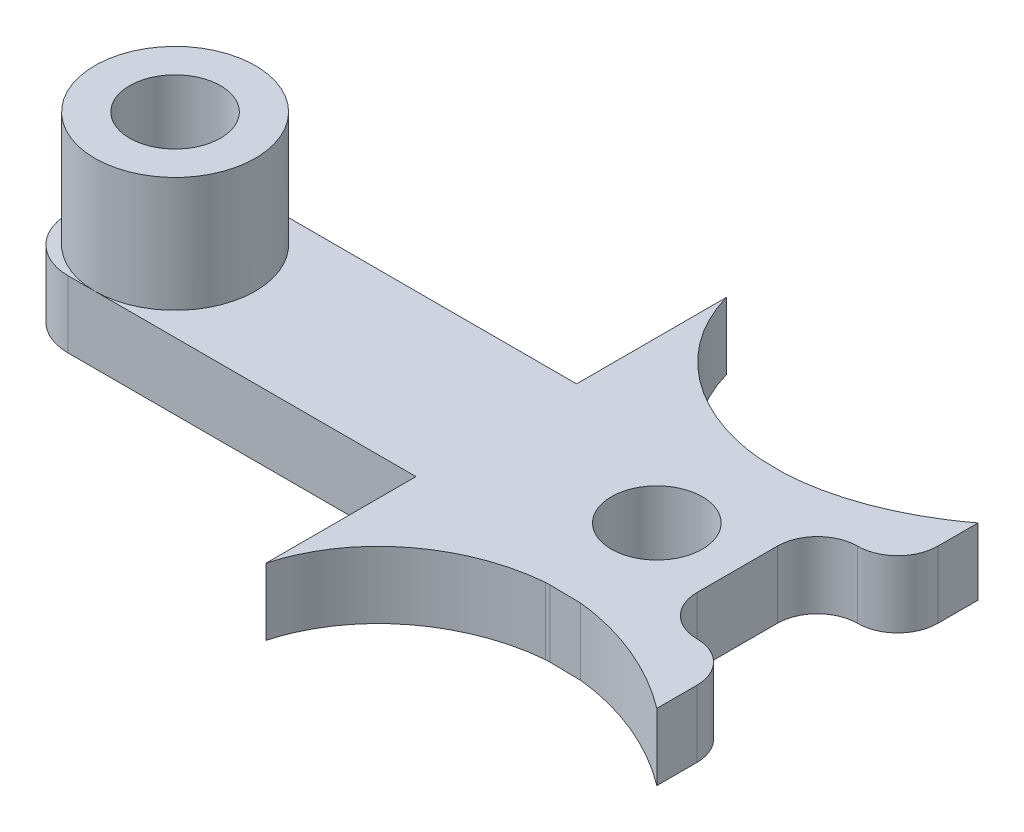
from build123d import *

# Parameters (mm, degrees)
SKETCH_1_R          = 1.7
EXTRUDE_1_DEPTH     = 2.5
SKETCH_3_R          = 3
SKETCH_3_R_2        = 1.7
EXTRUDE_2_DEPTH     = 4.3
EXTRUDE_3_DEPTH     = 2.5
EXTRUDE_4_DEPTH     = 2.5
CUT_EXTRUDE_2_DEPTH = 10
EXTRUDE_6_DEPTH     = 2.5
FILLET_START        = -1
FILLET_1_DEPTH      = 3.5
FILLET_1_2_DEPTH    = 2.5


with BuildPart() as part:
    # 草图1 → 凸台-拉伸1 (new body)
    with BuildSketch(Plane(origin=(0, 0, 0), x_dir=(1, 0, 0), z_dir=(0, 1, 0))):
        with BuildLine():
            Line((-10, 3), (10, 3))
            ThreePointArc((10, 3), (11.414213562, 2.414213562), (12, 1))
            Line((12, 1), (12, -1))
            ThreePointArc((12, -1), (11.414213562, -2.414213562), (10, -3))
            Line((10, -3), (-10, -3))
            ThreePointArc((-10, -3), (-11.414213562, -2.414213562), (-12, -1))
            Line((-12, -1), (-12, 1))
            ThreePointArc((-12, 1), (-11.414213562, 2.414213562), (-10, 3))
        make_face()
        with Locations(Location((-9, 0, 0), (0, 0, 270))):
            Circle(SKETCH_1_R, mode=Mode.SUBTRACT)
        with Locations(Location((9, 0, 0), (0, 0, 270))):
            Circle(SKETCH_1_R, mode=Mode.SUBTRACT)
    extrude(amount=EXTRUDE_1_DEPTH)

    # 草图3 → 凸台-拉伸2 (add)
    with BuildSketch(Plane(origin=(0, 2.5, 0), x_dir=(1, 0, 0), z_dir=(0, 1, 0))):
        with Locations(Location((-9, 0, 0), (0, 0, 270))):
            Circle(SKETCH_3_R)
        with Locations(Location((-9, 0, 0), (0, 0, 270))):
            Circle(SKETCH_3_R_2, mode=Mode.SUBTRACT)
    extrude(amount=EXTRUDE_2_DEPTH)

    # 草图4 → 凸台-拉伸3 (add)
    with BuildSketch(Plane.XZ):
        with BuildLine():
            Line((3, -3), (3, -6))
            add(Edge.make_bspline(
                [(9, -4), (5.683772234, -4.051316702), (3, -6)],
                knots=[0, 0, 0, 1, 1, 1], degree=2))
            add(Edge.make_bspline(
                [(9, -4), (12.316227766, -4.051316702), (15, -6)],
                knots=[0, 0, 0, 1, 1, 1], degree=2))
            Line((15, -6), (15, -3))
            Line((15, -3), (3, -3))
        make_face()
        with BuildLine():
            Line((3, 3), (15, 3))
            Line((15, 3), (15, 6))
            add(Edge.make_bspline(
                [(9, 4), (12.316227766, 4.051316702), (15, 6)],
                knots=[0, 0, 0, 1, 1, 1], degree=2))
            add(Edge.make_bspline(
                [(9, 4), (5.683772234, 4.051316702), (3, 6)],
                knots=[0, 0, 0, 1, 1, 1], degree=2))
            Line((3, 6), (3, 3))
        make_face()
    extrude(amount=-EXTRUDE_3_DEPTH)

    # 草图5 → 凸台-拉伸4 (add)
    with BuildSketch(Plane.XZ):
        Polygon((9.41538426, 3.145270203), (11.442509661, 0.357972777), (9.41538426, -3.078638254), (11.917617176, -3.601256521), (12, -3.235006375), (12, 3.620377719), align=None)
    extrude(amount=-EXTRUDE_4_DEPTH)

    # 草图10 → 切除-拉伸2 (cut)
    with BuildSketch(Plane.XZ):
        Polygon((9, 4), (14.708854471, 4.088341194), (15, 6), align=None)
        Polygon((9, -4), (14.512519064, -3.914696982), (15, -6), align=None)
    extrude(amount=-CUT_EXTRUDE_2_DEPTH, mode=Mode.SUBTRACT)

    # 草图11 → 凸台-拉伸6 (add)
    with BuildSketch(Plane.XZ):
        with BuildLine():
            Line((15, 6), (15, 3.4))
            Line((15, 3.4), (3, 3.4))
            Line((3, 3.4), (3, 8.6))
            add(Edge.make_bspline(
                [(3, 8.6), (3.743724888, 5.90317916), (8.383809549, 2.787162352), (13.287766409, 4.701526195), (15, 6)],
                knots=[0, 0, 0, 0, 0.541786912, 1, 1, 1, 1], degree=3))
        make_face()
        with BuildLine():
            Line((3, -8.6), (3, -3.580116595))
            Line((3, -3.580116595), (15, -3.580116595))
            Line((15, -3.580116595), (15, -6))
            add(Edge.make_bspline(
                [(15, -6), (13.28897523, -4.705122665), (8.381534555, -2.775849949), (3.754894418, -5.92427983), (3, -8.6)],
                knots=[0, 0, 0, 0, 0.458377401, 1, 1, 1, 1], degree=3))
        make_face()
    extrude(amount=-EXTRUDE_6_DEPTH)

    # 圆角1: read off the stored shape, not the designer's step
    # 圆角1 outline → 圆角1 (cut)
    with BuildSketch(Plane(origin=(0, 0, 0), x_dir=(1, 0, 0), z_dir=(0, 1, 0)).offset(FILLET_START)):
        with BuildLine():
            Line((15, -3), (13.5, -3))
            ThreePointArc((13.5, -3), (14.560660172, -3.439339828), (15, -4.5))
            Line((15, -4.5), (15, -3))
        make_face()
        with BuildLine():
            ThreePointArc((15, 4.5), (14.560660172, 3.439339828), (13.5, 3))
            Line((13.5, 3), (15, 3))
            Line((15, 3), (15, 4.5))
        make_face()
    extrude(amount=FILLET_1_DEPTH, mode=Mode.SUBTRACT)

    # Fillet 1 2 outline → Fillet 1 2 (add)
    with BuildSketch(Plane(origin=(0, 0, 0), x_dir=(1, 0, 0), z_dir=(0, 1, 0))):
        with BuildLine():
            ThreePointArc((13.5, -3), (12.439339828, -2.560660172), (12, -1.5))
            Line((12, -1.5), (12, -3))
            Line((12, -3), (13.5, -3))
        make_face()
        with BuildLine():
            ThreePointArc((12, 1.5), (12.439339828, 2.560660172), (13.5, 3))
            Line((13.5, 3), (12, 3))
            Line((12, 3), (12, 1.5))
        make_face()
    extrude(amount=FILLET_1_2_DEPTH)


solid = part.part
